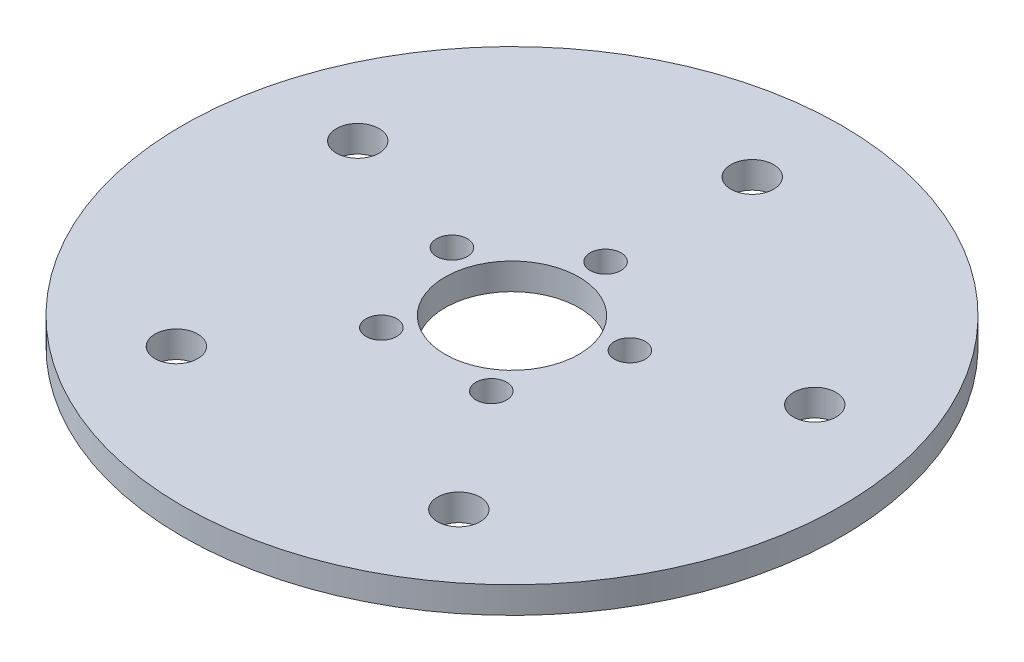
from build123d import *

# Parameters (mm, degrees)
SKETCH1_R           = 39.37
BOSS_EXTRUDE1_DEPTH = 3.175
SKETCH2_R           = 8.001
SKETCH2_R_2         = 1.8415
SKETCH2_R_3         = 2.5527
CUT_EXTRUDE1_DEPTH  = 56.768041251


with BuildPart() as part:
    # Sketch1 → Boss-Extrude1 (new body)
    with BuildSketch(Plane(origin=(0, 807.11642412, 0), x_dir=(-1, 0, 0), z_dir=(0, 1, 0))):
        Circle(SKETCH1_R)
    extrude(amount=-BOSS_EXTRUDE1_DEPTH)

    # Sketch2 → Cut-Extrude1 (cut, through all)
    with BuildSketch(Plane(origin=(0, 807.11642412, 0), x_dir=(1, 0, 0), z_dir=(0, 1, 0))):
        Circle(SKETCH2_R)
        with Locations((0, 11.176)):
            Circle(SKETCH2_R_2)
        with Locations((10.629007626, 3.453573929)):
            Circle(SKETCH2_R_2)
        with Locations((6.56908798, -9.041573929)):
            Circle(SKETCH2_R_2)
        with Locations((-6.56908798, -9.041573929)):
            Circle(SKETCH2_R_2)
        with Locations((-10.629007626, 3.453573929)):
            Circle(SKETCH2_R_2)
        with Locations((0, 28.702)):
            Circle(SKETCH2_R_3)
        with Locations((27.297224131, 8.869405773)):
            Circle(SKETCH2_R_3)
        with Locations((16.870612311, -23.220405773)):
            Circle(SKETCH2_R_3)
        with Locations((-16.870612311, -23.220405773)):
            Circle(SKETCH2_R_3)
        with Locations((-27.297224131, 8.869405773)):
            Circle(SKETCH2_R_3)
    extrude(amount=-CUT_EXTRUDE1_DEPTH, mode=Mode.SUBTRACT)


solid = part.part
